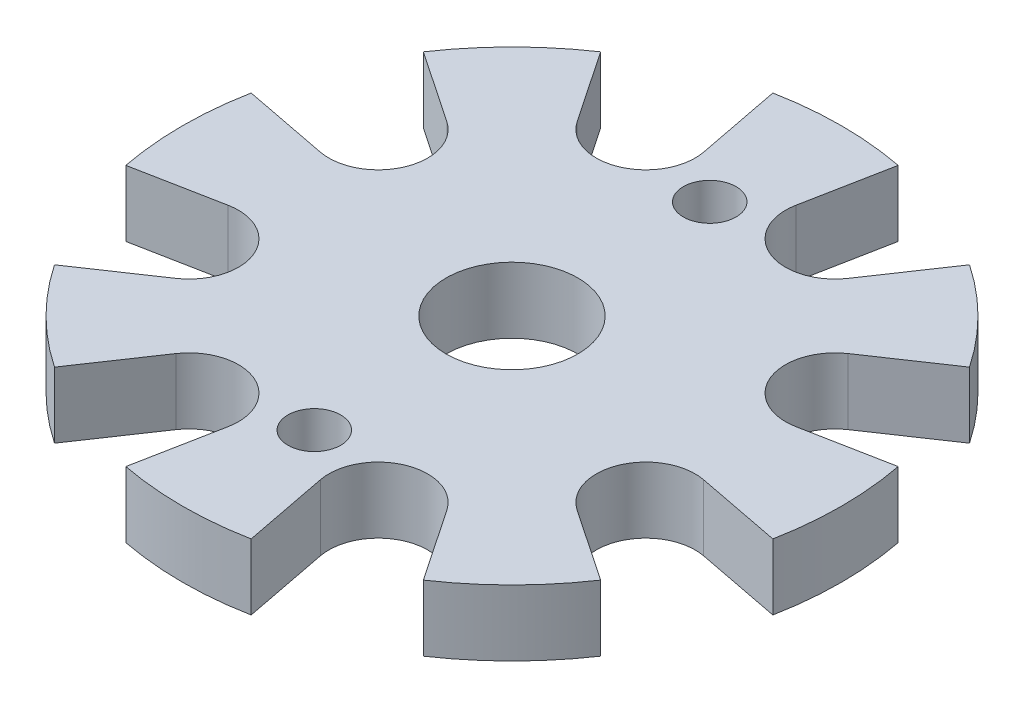
from build123d import *

# Parameters (mm, degrees)
SKETCH1_R           = 20
BOSS_EXTRUDE1_DEPTH = 4
CUT_EXTRUDE1_REACH  = 30.566
SKETCH2_R           = 4
SKETCH2_R_2         = 1.6
CUT_EXTRUDE3_REACH  = 30.566
CIRPATTERN1_COUNT   = 8


with BuildPart() as part:
    # Sketch1 → Boss-Extrude1 (new body)
    with BuildSketch(Plane(origin=(0, 0, 0), x_dir=(1, 0, 0), z_dir=(0, 1, 0))):
        Circle(SKETCH1_R)
    extrude(amount=BOSS_EXTRUDE1_DEPTH)

    # Sketch2 → Cut-Extrude1 (cut, up to next)
    with BuildSketch(Plane(origin=(0, 0, 0), x_dir=(1, 0, 0), z_dir=(0, 1, 0)), mode=Mode.PRIVATE) as cut_extrude1_sk1:
        Circle(SKETCH2_R)
    cut_extrude1_tool1 = extrude(cut_extrude1_sk1.sketch, amount=CUT_EXTRUDE1_REACH, mode=Mode.PRIVATE) & part.part
    # Sketch2 → Cut-Extrude1 (cut, up to next)
    with BuildSketch(Plane(origin=(0, 0, 0), x_dir=(1, 0, 0), z_dir=(0, 1, 0)), mode=Mode.PRIVATE) as cut_extrude1_sk2:
        with Locations((0, 12)):
            Circle(SKETCH2_R_2)
    cut_extrude1_tool2 = extrude(cut_extrude1_sk2.sketch, amount=CUT_EXTRUDE1_REACH, mode=Mode.PRIVATE) & part.part
    # Sketch2 → Cut-Extrude1 (cut, up to next)
    with BuildSketch(Plane(origin=(0, 0, 0), x_dir=(1, 0, 0), z_dir=(0, 1, 0)), mode=Mode.PRIVATE) as cut_extrude1_sk3:
        with Locations((0, -12)):
            Circle(SKETCH2_R_2)
    cut_extrude1_tool3 = extrude(cut_extrude1_sk3.sketch, amount=CUT_EXTRUDE1_REACH, mode=Mode.PRIVATE) & part.part
    add(cut_extrude1_tool1.solids().sort_by_distance((0, 0, 0))[0], mode=Mode.SUBTRACT)
    add(cut_extrude1_tool2.solids().sort_by_distance((0, 0, -12))[0], mode=Mode.SUBTRACT)
    add(cut_extrude1_tool3.solids().sort_by_distance((0, 0, 12))[0], mode=Mode.SUBTRACT)

    # Sketch3 → Cut-Extrude3 (cut, up to next)
    with BuildSketch(Plane(origin=(0, 0, 0), x_dir=(1, 0, 0), z_dir=(0, 1, 0)), mode=Mode.PRIVATE) as cut_extrude3_sk1:
        with BuildLine():
            ThreePointArc((11.194551269, 16.573533778), (7.653668647, 18.47759065), (3.803515008, 19.635001237))
            Line((3.803515008, 19.635001237), (2.7950013, 14.428720239))
            ThreePointArc((2.7950013, 14.428720239), (4.592201188, 11.08655439), (8.226281552, 12.179010297))
            Line((8.226281552, 12.179010297), (11.194551269, 16.573533778))
        make_face()
    cut_extrude3_tool1 = extrude(cut_extrude3_sk1.sketch, amount=CUT_EXTRUDE3_REACH, mode=Mode.PRIVATE) & part.part
    cut_extrude3 = cut_extrude3_tool1.solids().sort_by_distance((6.290655, 0, -15.186984))[0]
    add(cut_extrude3, mode=Mode.SUBTRACT)

    # CirPattern1: Cut-Extrude3 ×8 about axis
    cirpattern1_axis = Axis((0, 4, 0), (0, 1, 0))
    for i in range(1, CIRPATTERN1_COUNT):
        add(cut_extrude3.rotate(cirpattern1_axis, i * 360 / CIRPATTERN1_COUNT), mode=Mode.SUBTRACT)


solid = part.part
